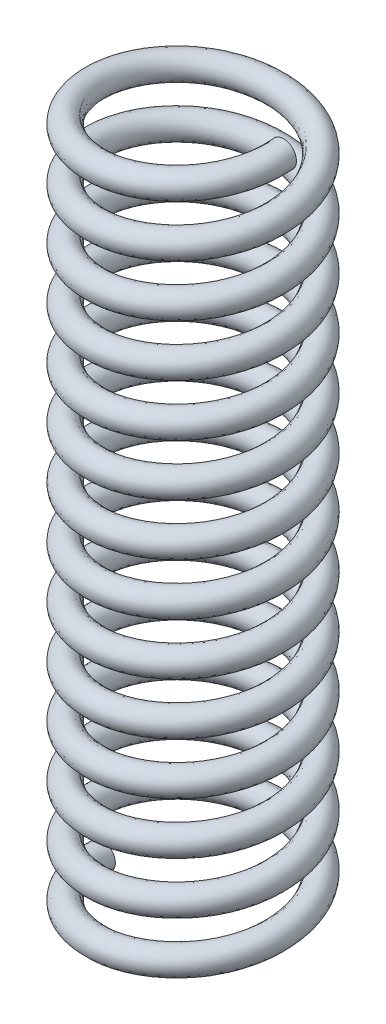
from build123d import *

# Parameters (mm, degrees)
SPRING_PITCH          = 1
SPRING_HEIGHT         = 13.5
SPRING_RADIUS         = 1.75
SPRING_START_ANGLE    = 90
SPRINGBODYDIAMETERS_R = 0.25


with BuildPart() as part:
    # SPRING: sweep along a helix
    with BuildLine() as spring_path:
        add(Helix(SPRING_PITCH, SPRING_HEIGHT, SPRING_RADIUS, center=(0, 0, 0), direction=(0, -1, 0), mode=Mode.PRIVATE).rotate(Axis((0, 0, 0), (0, -1, 0)), SPRING_START_ANGLE))
    # SpringBodyDiameterS → SPRING (sweep)
    with BuildSketch(Plane.XY):
        with Locations((1.75, 0)):
            Circle(SPRINGBODYDIAMETERS_R)
    sweep(path=spring_path.line, is_frenet=True)


solid = part.part
